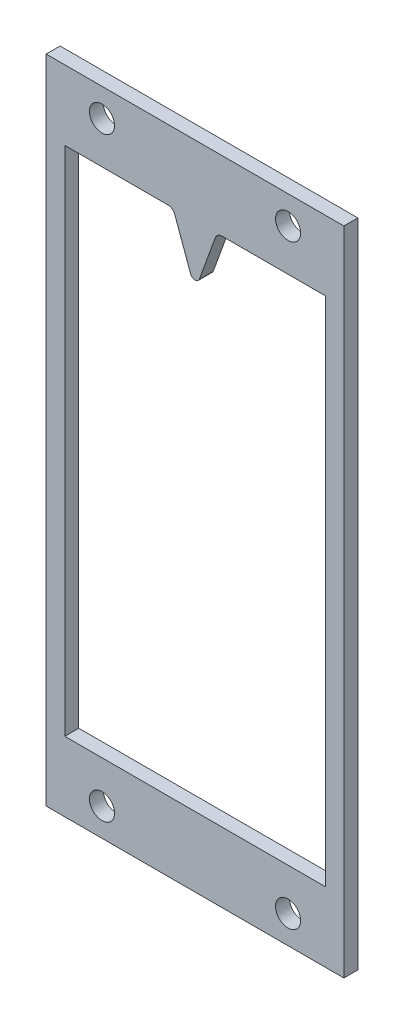
from build123d import *

# Parameters (mm, degrees)
SKETCH1_W           = 64
SKETCH1_H           = 140
SKETCH1_R           = 2.699339217
BOSS_EXTRUDE1_DEPTH = 3
FILLET1_R           = 1.5


with BuildPart() as part:
    # Sketch1 → Boss-Extrude1 (new body)
    with BuildSketch(Plane.XY):
        with Locations((28, -55)):
            Rectangle(SKETCH1_W, SKETCH1_H)
        with Locations((8, 9)):
            Circle(SKETCH1_R, mode=Mode.SUBTRACT)
        with Locations((48, 9)):
            Circle(SKETCH1_R, mode=Mode.SUBTRACT)
        with Locations((48, -119)):
            Circle(SKETCH1_R, mode=Mode.SUBTRACT)
        with Locations((8, -119)):
            Circle(SKETCH1_R, mode=Mode.SUBTRACT)
        with BuildLine():
            Line((0, 0), (23.268386955, 0))
            Line((23.268386955, 0), (27.060307379, -10.418215743))
            ThreePointArc((27.060307379, -10.418215743), (28, -11.0761956), (28.939692621, -10.418215743))
            Line((28.939692621, -10.418215743), (32.731613045, 0))
            Line((32.731613045, 0), (56, 0))
            Line((56, 0), (56, -110))
            Line((56, -110), (0, -110))
            Line((0, -110), (0, 0))
        make_face(mode=Mode.SUBTRACT)
    extrude(amount=BOSS_EXTRUDE1_DEPTH)

    # Fillet1
    fillet1_edges = [part.edges().sort_by_distance(p)[0] for p in [
        (23.268386955, 0, 1.5),
        (32.731613045, 0, 1.5),
    ]]
    fillet(fillet1_edges, radius=FILLET1_R)


solid = part.part
